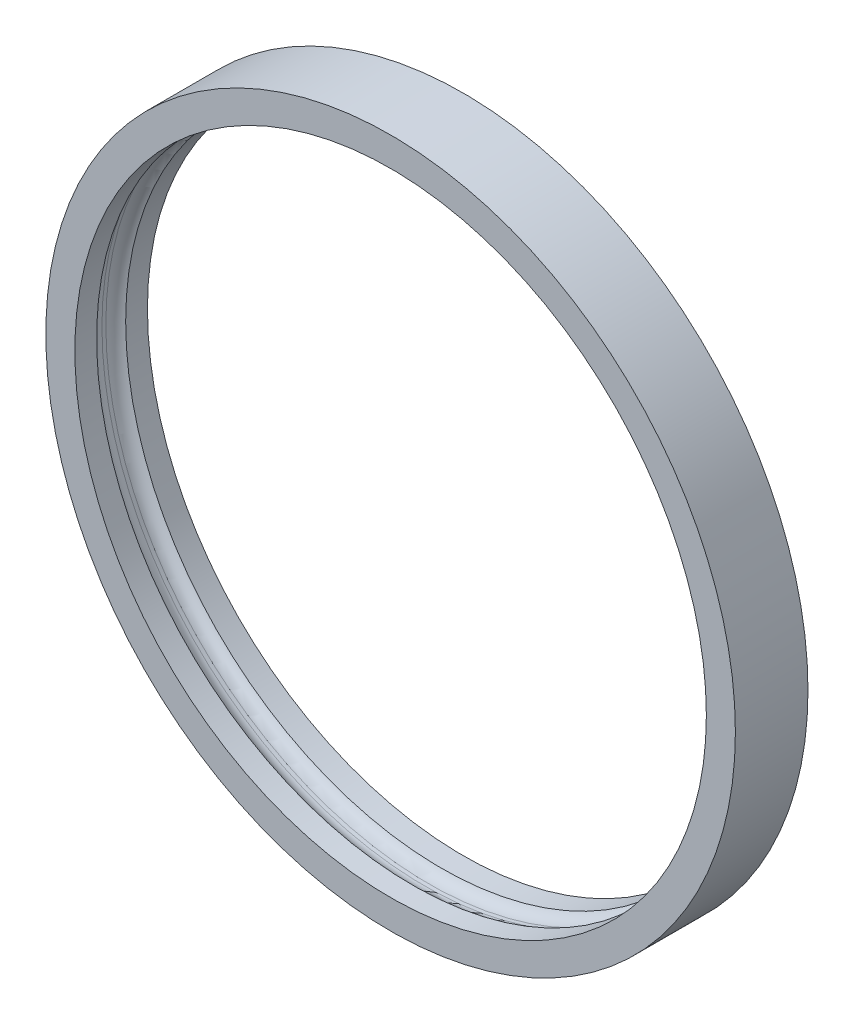
from build123d import *

# Parameters (mm, degrees)
SKETCH_1_R      = 47.5
SKETCH_1_R_2    = 44.5
EXTRUDE_2_DEPTH = 10
EXTRUDE_START   = -3
SKETCH_2_R      = 44.5
SKETCH_2_R_2    = 43.5
EXTRUDE_3_DEPTH = 3
FILLET_1_R      = 2
SKETCH_3_R      = 44.5
SKETCH_3_R_2    = 43.5
EXTRUDE_4_DEPTH = 3
FILLET_2_R      = 2


with BuildPart() as part:
    # 草图1 → 凸台-拉伸2 (new body)
    with BuildSketch(Plane.XY):
        Circle(SKETCH_1_R)
        Circle(SKETCH_1_R_2, mode=Mode.SUBTRACT)
    extrude(amount=EXTRUDE_2_DEPTH)

    # 草图2 → 凸台-拉伸3 (add)
    with BuildSketch(Plane.XY.offset(10).offset(EXTRUDE_START)):
        Circle(SKETCH_2_R)
        Circle(SKETCH_2_R_2, mode=Mode.SUBTRACT)
    extrude(amount=EXTRUDE_3_DEPTH)

    # 圆角1
    # the kernel refuses this fillet: 2 mm, written as the material it adds along each edge
    with BuildSketch(Plane(origin=(0, 0, 7), x_dir=(1, 0, 0), z_dir=(0, -1, 0))) as fillet_1_piece_1:
        with BuildLine():
            CenterArc((42.5, -1.732050808), FILLET_1_R, 0, 60)
            Line((43.5, 0), (43.52, 0.034641016))
            ThreePointArc((43.52, 0.034641016), (44, 0.04), (44.5, 0.04))
            Line((44.5, 0.04), (44.54, 0))
            Line((44.54, 0), (44.54, -1.732050808))
            Line((44.54, -1.732050808), (44.5, -1.732050808))
        make_face()
    revolve(axis=Axis((0, 0, 7), (0, 0, 1)))

    # 草图3 → 凸台-拉伸4 (add)
    with BuildSketch(Plane(origin=(0, 0, 0), x_dir=(-1, 0, 0), z_dir=(0, 0, -1))):
        Circle(SKETCH_3_R)
        with Locations(Location((0, 0, 0), (0, 0, 180))):
            Circle(SKETCH_3_R_2, mode=Mode.SUBTRACT)
    extrude(amount=-EXTRUDE_4_DEPTH)

    # 圆角2
    # the kernel refuses this fillet: 2 mm, written as the material it adds along each edge
    with BuildSketch(Plane(origin=(0, 0, 3), x_dir=(1, 0, 0), z_dir=(0, 1, 0))) as fillet_2_piece_1:
        with BuildLine():
            CenterArc((42.5, -1.732050808), FILLET_2_R, 0, 60)
            Line((43.5, 0), (43.52, 0.034641016))
            ThreePointArc((43.52, 0.034641016), (44, 0.04), (44.5, 0.04))
            Line((44.5, 0.04), (44.54, 0))
            Line((44.54, 0), (44.54, -1.732050808))
            Line((44.54, -1.732050808), (44.5, -1.732050808))
        make_face()
    revolve(axis=Axis((0, 0, 3), (0, 0, -1)))


solid = part.part
